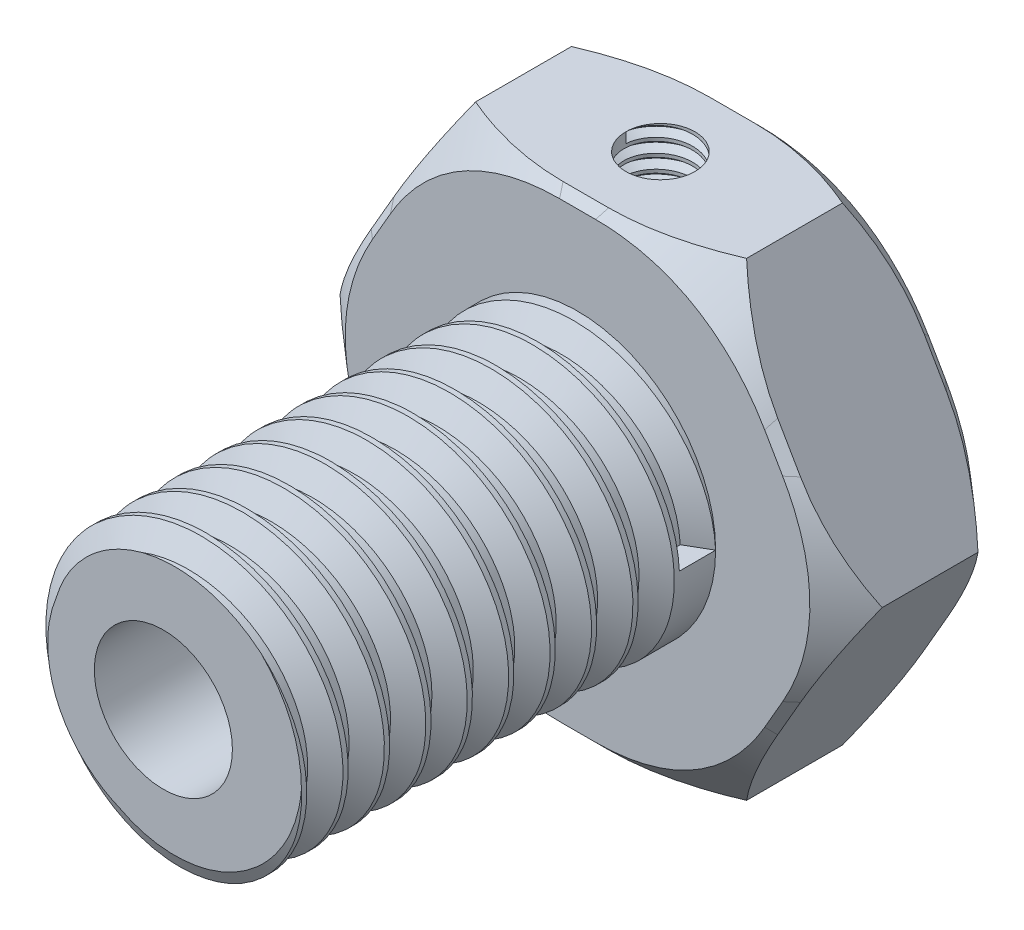
from build123d import *

# Parameters (mm, degrees)
BOSS_EXTRUDE1_DEPTH              = 6
SKETCH2_R                        = 5
BOSS_EXTRUDE2_DEPTH              = 15
THREAD1_PITCH                    = 1.5
CHAMFER1_SIZE                    = 0.4
FILLET1_R                        = 10
CHAMFER2_SIZE                    = 0.3
FILLET2_R                        = 10
SKETCH6_R                        = 2.5
CUT_EXTRUDE1_DEPTH               = 21
CHAMFER3_SIZE                    = 0.5
TAP_DRILL_SLOT_FOR_M3_TAP1_D     = 2.5
TAP_DRILL_SLOT_FOR_M3_TAP1_DEPTH = 8.499
TAP_DRILL_SLOT_FOR_M3_TAP1_TIP   = 0.751075774
THREAD2_PITCH                    = 0.5


with BuildPart() as part:
    # Sketch1 → Boss-Extrude1 (new body)
    with BuildSketch(Plane.XY):
        Polygon((4.907477288, -8.5), (9.814954576, 0), (4.907477288, 8.5), (-4.907477288, 8.5), (-9.814954576, 0), (-4.907477288, -8.5), align=None)
    extrude(amount=BOSS_EXTRUDE1_DEPTH)

    # Sketch2 → Boss-Extrude2 (add)
    with BuildSketch(Plane.XY.offset(6)):
        Circle(SKETCH2_R)
    extrude(amount=BOSS_EXTRUDE2_DEPTH)

    # Thread1: the profile of Thread Profile1 profile screwed along a right-hand helix of 10 turns, 8 arcs to a turn; built about Z, then put on its axis
    thread1_z = Axis((0, 0, 0), (0, 0, 1))
    thread1_corners = [(5.0003, 0, -0.000173205), (5.0003, 0, 1.312673201), (4.188101188, 0, 0.843749998), (4.188101188, 0, 0.468749998)]
    with BuildLine(mode=Mode.PRIVATE) as thread1_profile:
        Line(thread1_corners[0], thread1_corners[1])
        Line(thread1_corners[1], thread1_corners[2])
        Line(thread1_corners[2], thread1_corners[3])
        Line(thread1_corners[3], thread1_corners[0])
    thread1_cap = Face(thread1_profile.wire())
    thread1_turn_angles = [0, 22.5, 45, 67.5, 90, 112.5, 135, 157.5, 180, 202.5, 225, 247.5, 270, 292.5, 315, 337.5, 360]
    thread1_turn_weights = [1, 0.9238795325112867, 1, 0.9238795325112867, 1, 0.9238795325112867, 1, 0.9238795325112867, 1, 0.9238795325112867, 1, 0.9238795325112867, 1, 0.9238795325112867, 1, 0.9238795325112867, 1]
    thread1_turn_rails = [Edge.make_bspline([Vector(p[0], p[1], 0).rotate(thread1_z, thread1_turn_angles[k]) / thread1_turn_weights[k] + Vector(0, 0, p[2] + THREAD1_PITCH * thread1_turn_angles[k] / 360) for k in range(17)], [0, 0, 0, 1, 1, 2, 2, 3, 3, 4, 4, 5, 5, 6, 6, 7, 7, 8, 8, 8], 2, thread1_turn_weights) for p in thread1_corners]
    thread1_turn_sides = [Face.make_surface_from_curves(thread1_turn_rails[p[0]], thread1_turn_rails[p[1]]) for p in [(0, 1), (1, 2), (2, 3), (3, 0)]]
    thread1 = Plane(origin=(0, 0, 6), x_dir=(1, 0, 0), z_dir=(0, 0, 1)) * Solid(Shell([*[p.moved(Location((0, 0, THREAD1_PITCH * i))) for i in range(10) for p in thread1_turn_sides], thread1_cap, thread1_cap.rotate(thread1_z, 3600).moved(Location((0, 0, THREAD1_PITCH * 3600 / 360)))]))
    add(thread1, mode=Mode.SUBTRACT)

    # Chamfer1
    chamfer1_edges = [part.edges().sort_by_distance(p)[0] for p in [
        (-7.361215932, -4.25, 0),
        (-7.361215932, 4.25, 0),
        (0, 8.5, 0),
        (7.361215932, 4.25, 0),
        (7.361215932, -4.25, 0),
        (0, -8.5, 0),
    ]]
    chamfer(chamfer1_edges, length=CHAMFER1_SIZE)

    # Fillet1
    fillet1_edges = [part.edges().sort_by_distance(p)[0] for p in [
        (-9.584014469, 0, 0.2),
        (-4.792007234, 8.3, 0.2),
        (-4.792007234, -8.3, 0.2),
        (4.792007234, 8.3, 0.2),
        (4.792007234, -8.3, 0.2),
        (9.584014469, 0, 0.2),
    ]]
    fillet(fillet1_edges, radius=FILLET1_R)

    # Chamfer2
    chamfer2_edges = [part.edges().sort_by_distance(p)[0] for p in [
        (7.361215932, 4.25, 6),
        (0, 8.5, 6),
        (-7.361215932, 4.25, 6),
        (-7.361215932, -4.25, 6),
        (0, -8.5, 6),
        (7.361215932, -4.25, 6),
    ]]
    chamfer(chamfer2_edges, length=CHAMFER2_SIZE)

    # Fillet2
    fillet2_edges = [part.edges().sort_by_distance(p)[0] for p in [
        (9.641749495, 0, 5.85),
        (4.820874748, -8.35, 5.85),
        (4.820874748, 8.35, 5.85),
        (-4.820874748, -8.35, 5.85),
        (-4.820874748, 8.35, 5.85),
        (-9.641749495, 0, 5.85),
    ]]
    fillet(fillet2_edges, radius=FILLET2_R)

    # Sketch6 → Cut-Extrude1 (cut)
    with BuildSketch(Plane(origin=(0, 0, 0), x_dir=(-1, 0, 0), z_dir=(0, 0, -1))):
        Circle(SKETCH6_R)
    extrude(amount=-CUT_EXTRUDE1_DEPTH, mode=Mode.SUBTRACT)

    # Chamfer3
    chamfer3_edges = [part.edges().sort_by_distance(p)[0] for p in [
        (2.5, 0, 0),
    ]]
    chamfer(chamfer3_edges, length=CHAMFER3_SIZE)

    # Tap Drill Slot for M3 Tap1
    with Locations(Plane(origin=(0, 8.5, 0), x_dir=(1, 0, 0), z_dir=(0, 1, 0))):
        with Locations((0, -3)):
            Hole(TAP_DRILL_SLOT_FOR_M3_TAP1_D / 2, depth=TAP_DRILL_SLOT_FOR_M3_TAP1_DEPTH)
            with Locations((0, 0, -(TAP_DRILL_SLOT_FOR_M3_TAP1_DEPTH + TAP_DRILL_SLOT_FOR_M3_TAP1_TIP / 2))):  # 118° drill point
                Cone(0, TAP_DRILL_SLOT_FOR_M3_TAP1_D / 2, TAP_DRILL_SLOT_FOR_M3_TAP1_TIP, mode=Mode.SUBTRACT)

    # Thread2: the profile of Thread Profile4 profile screwed along a right-hand helix of 14 turns, 6 arcs to a turn; built about Z, then put on its axis
    thread2_z = Axis((0, 0, 0), (0, 0, 1))
    thread2_corners = [(1.2497, 0, -0.000173205), (1.520632937, 0, 0.156249999), (1.520632937, 0, 0.218749999), (1.2497, 0, 0.375173204)]
    with BuildLine(mode=Mode.PRIVATE) as thread2_profile:
        Line(thread2_corners[0], thread2_corners[1])
        Line(thread2_corners[1], thread2_corners[2])
        Line(thread2_corners[2], thread2_corners[3])
        Line(thread2_corners[3], thread2_corners[0])
    thread2_cap = Face(thread2_profile.wire())
    thread2_turn_angles = [0, 30, 60, 90, 120, 150, 180, 210, 240, 270, 300, 330, 360]
    thread2_turn_weights = [1, 0.8660254037844387, 1, 0.8660254037844387, 1, 0.8660254037844387, 1, 0.8660254037844387, 1, 0.8660254037844387, 1, 0.8660254037844387, 1]
    thread2_turn_rails = [Edge.make_bspline([Vector(p[0], p[1], 0).rotate(thread2_z, thread2_turn_angles[k]) / thread2_turn_weights[k] + Vector(0, 0, p[2] + THREAD2_PITCH * thread2_turn_angles[k] / 360) for k in range(13)], [0, 0, 0, 1, 1, 2, 2, 3, 3, 4, 4, 5, 5, 6, 6, 6], 2, thread2_turn_weights) for p in thread2_corners]
    thread2_turn_sides = [Face.make_surface_from_curves(thread2_turn_rails[p[0]], thread2_turn_rails[p[1]]) for p in [(0, 1), (1, 2), (2, 3), (3, 0)]]
    thread2 = Plane(origin=(0, 8.5, 3), x_dir=(-1, 0, 0), z_dir=(0, -1, 0)) * Solid(Shell([*[p.moved(Location((0, 0, THREAD2_PITCH * i))) for i in range(14) for p in thread2_turn_sides], thread2_cap, thread2_cap.rotate(thread2_z, 5040).moved(Location((0, 0, THREAD2_PITCH * 5040 / 360)))]))
    add(thread2, mode=Mode.SUBTRACT)


solid = part.part
